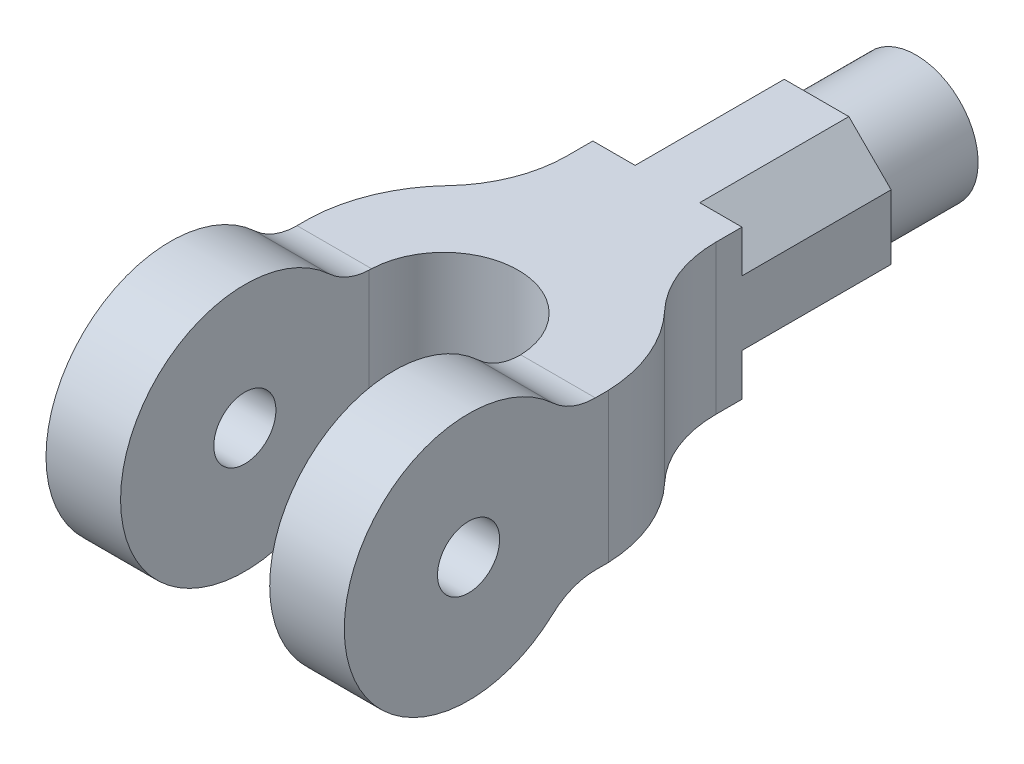
from build123d import *

# Parameters (mm, degrees)
SKETCH1_W           = 120
SKETCH1_H           = 250
BOSS_EXTRUDE2_DEPTH = 100
CUT_EXTRUDE1_DEPTH  = 295.78805946
SKETCH5_R           = 12.5
CUT_EXTRUDE3_DEPTH  = 295.78805946
CUT_EXTRUDE4_DEPTH  = 60
SKETCH6_3_R         = 25
BOSS_EXTRUDE3_DEPTH = 40


with BuildPart() as part:
    # Sketch1 → Boss-Extrude2 (new body)
    with BuildSketch(Plane(origin=(0, 0, 0), x_dir=(1, 0, 0), z_dir=(0, 1, 0))):
        with Locations((-60, 125)):
            Rectangle(SKETCH1_W, SKETCH1_H)
    extrude(amount=BOSS_EXTRUDE2_DEPTH)

    # Sketch4 → Cut-Extrude1 (cut, through all)
    with BuildSketch(Plane(origin=(0, 100, 0), x_dir=(1, 0, 0), z_dir=(0, 1, 0))):
        with BuildLine():
            ThreePointArc((-30, 100), (-60, 130), (-90, 100))
            Line((-90, 100), (-90, 0))
            Line((-90, 0), (-30, 0))
            Line((-30, 0), (-30, 100))
        make_face()
        with BuildLine():
            Line((0, 250), (-30, 250))
            Line((-30, 250), (-30, 179.561593793))
            ThreePointArc((-30, 179.561593793), (-26.46215881, 161.088158847), (-16.349288051, 145.228967063))
            ThreePointArc((-16.349288051, 145.228967063), (-4.636985506, 127.241105931), (0, 106.283063455))
            Line((0, 106.283063455), (0, 250))
        make_face()
        with BuildLine():
            Line((-90, 179.561593793), (-90, 250))
            Line((-90, 250), (-120, 250))
            Line((-120, 250), (-120, 106.283063455))
            ThreePointArc((-120, 106.283063455), (-115.363014494, 127.241105931), (-103.650711949, 145.228967063))
            ThreePointArc((-103.650711949, 145.228967063), (-93.53784119, 161.088158847), (-90, 179.561593793))
        make_face()
    extrude(amount=-CUT_EXTRUDE1_DEPTH, mode=Mode.SUBTRACT)

    # Sketch5 → Cut-Extrude3 (cut, through all)
    with BuildSketch(Plane(origin=(0, 0, 0), x_dir=(0, 0, -1), z_dir=(1, 0, 0))):
        with BuildLine():
            Line((50, 100), (0, 100))
            Line((0, 100), (0, 50))
            ThreePointArc((0, 50), (14.644660941, 85.355339059), (50, 100))
        make_face()
        with BuildLine():
            ThreePointArc((50, 100), (68.257418584, 96.547466813), (83.993463424, 86.666666667))
            ThreePointArc((83.993463424, 86.666666667), (91.861485844, 81.726266594), (100.990195136, 80))
            Line((100.990195136, 80), (250, 80))
            Line((250, 80), (250, 100))
            Line((250, 100), (50, 100))
        make_face()
        with BuildLine():
            ThreePointArc((50.000000014, 0), (14.644660946, 14.644660936), (0, 50))
            Line((0, 50), (0, 0))
            Line((0, 0), (50.000000014, 0))
        make_face()
        with BuildLine():
            ThreePointArc((83.993463424, 13.333333333), (68.25741859, 3.45253319), (50.000000014, 0))
            Line((50.000000014, 0), (250, 0))
            Line((250, 0), (250, 20))
            Line((250, 20), (100.990195136, 20))
            ThreePointArc((100.990195136, 20), (91.861485844, 18.273733406), (83.993463424, 13.333333333))
        make_face()
        with Locations((50, 50)):
            Circle(SKETCH5_R)
    extrude(amount=-CUT_EXTRUDE3_DEPTH, mode=Mode.SUBTRACT)

    # Sketch6 → Cut-Extrude4 (cut)
    with BuildSketch(Plane(origin=(0, 0, -250), x_dir=(-1, 0, 0), z_dir=(0, 0, -1))):
        Polygon((90, 63), (90, 80), (73, 80), align=None)
        Polygon((90, 20), (90, 37), (73, 20), align=None)
        Polygon((30, 63), (47, 80), (30, 80), align=None)
        Polygon((47, 20), (30, 37), (30, 20), align=None)
    extrude(amount=-CUT_EXTRUDE4_DEPTH, mode=Mode.SUBTRACT)

    # Sketch6<3> → Boss-Extrude3 (add)
    with BuildSketch(Plane(origin=(0, 0, -250), x_dir=(-1, 0, 0), z_dir=(0, 0, -1))):
        with Locations((60, 50)):
            Circle(SKETCH6_3_R)
    extrude(amount=BOSS_EXTRUDE3_DEPTH)


solid = part.part
